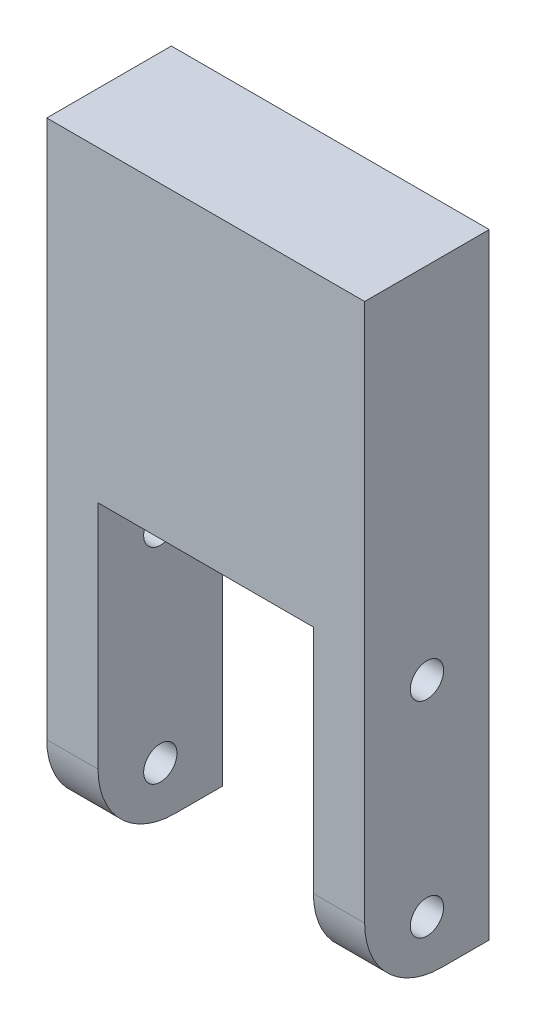
from build123d import *

# Parameters (mm, degrees)
BOSS_EXTRUDE1_DEPTH     = 12.15
CUT_EXTRUDE1_DEPTH      = 125.533619959
CUT_EXTRUDE1_DEPTH_BACK = 125.533619959
SKETCH3_R               = 3.25
FILLET1_R               = 15


with BuildPart() as part:
    # Sketch2 → Boss-Extrude1 (new, symmetric)
    with BuildSketch(Plane.XY):
        Polygon((-31, 0), (31, 0), (31, -120), (21, -120), (21, -60), (-21, -60), (-21, -120), (-31, -120), align=None)
    extrude(amount=BOSS_EXTRUDE1_DEPTH, both=True)

    # Sketch3 → Cut-Extrude1 (cut, two sides: drawn at the far end of the back side and taken through both)
    with BuildSketch(Plane(origin=(0, 0, 0), x_dir=(0, 0, -1), z_dir=(1, 0, 0)).offset(-CUT_EXTRUDE1_DEPTH_BACK)):
        with Locations((0, -70)):
            Circle(SKETCH3_R)
        with Locations((0, -110)):
            Circle(SKETCH3_R)
    extrude(amount=CUT_EXTRUDE1_DEPTH + CUT_EXTRUDE1_DEPTH_BACK, mode=Mode.SUBTRACT)

    # Fillet1
    fillet1_edges = [part.edges().sort_by_distance(p)[0] for p in [
        (26, -120, 12.15),
        (-26, -120, 12.15),
    ]]
    fillet(fillet1_edges, radius=FILLET1_R)


solid = part.part
